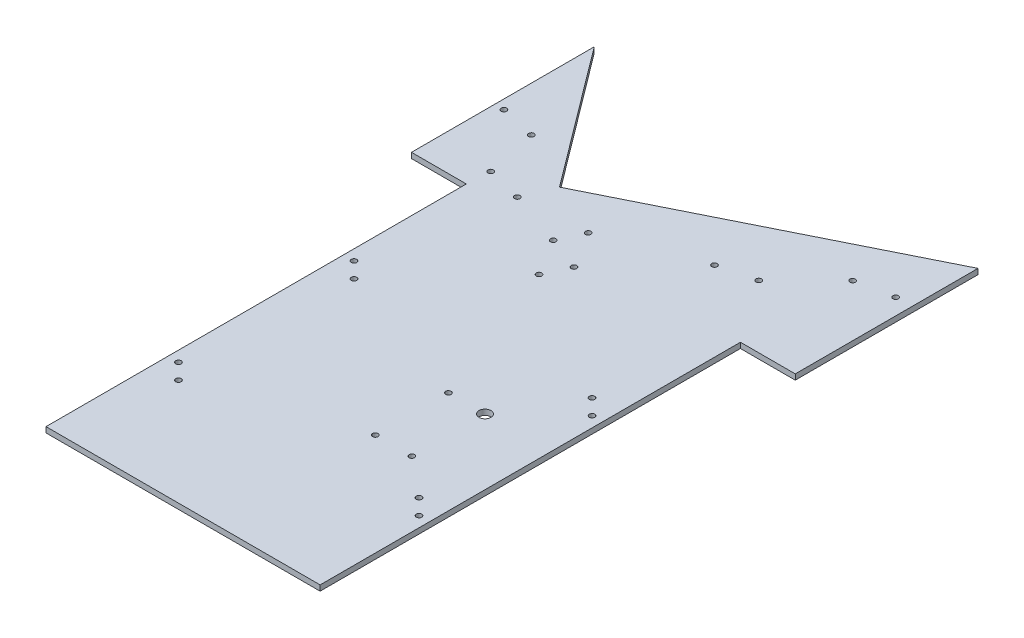
from build123d import *

# Parameters (mm, degrees)
SKETCH1_W           = 150
SKETCH1_H           = 200
SKETCH1_R           = 1.5
SKETCH1_R_2         = 3.263802796
BOSS_EXTRUDE1_DEPTH = 3
SKETCH2_R           = 1.5
SKETCH2_R_2         = 1.500000003
SKETCH2_R_3         = 1.500000002
SKETCH2_R_4         = 1.499999997
SKETCH2_R_5         = 1.499999998
BOSS_EXTRUDE3_DEPTH = 3


with BuildPart() as part:
    # Sketch1 → Boss-Extrude1 (new body)
    with BuildSketch(Plane(origin=(0, 0, 0), x_dir=(1, 0, 0), z_dir=(0, 1, 0))):
        Rectangle(SKETCH1_W, SKETCH1_H)
        with Locations((-69.242640687, 62.79605759)):
            Circle(SKETCH1_R, mode=Mode.SUBTRACT)
        with Locations((-60.757359313, 54.310776216)):
            Circle(SKETCH1_R, mode=Mode.SUBTRACT)
        with Locations((60.757359313, 63.034810844)):
            Circle(SKETCH1_R, mode=Mode.SUBTRACT)
        with Locations((69.242640687, 54.54952947)):
            Circle(SKETCH1_R, mode=Mode.SUBTRACT)
        with Locations((-69.242640687, -33.274226936)):
            Circle(SKETCH1_R, mode=Mode.SUBTRACT)
        with Locations((-60.757359313, -41.75950831)):
            Circle(SKETCH1_R, mode=Mode.SUBTRACT)
        with Locations((60.757359313, -31.641853854)):
            Circle(SKETCH1_R, mode=Mode.SUBTRACT)
        with Locations((69.242640687, -40.127135228)):
            Circle(SKETCH1_R, mode=Mode.SUBTRACT)
        with Locations((19.1, 26.102840582)):
            Circle(SKETCH1_R, mode=Mode.SUBTRACT)
        with Locations((39.1, 26.102840582)):
            Circle(SKETCH1_R_2, mode=Mode.SUBTRACT)
        with Locations((39.1, -13.897159418)):
            Circle(SKETCH1_R, mode=Mode.SUBTRACT)
        with Locations((19.1, -13.897159418)):
            Circle(SKETCH1_R, mode=Mode.SUBTRACT)
    extrude(amount=BOSS_EXTRUDE1_DEPTH)

    # Sketch2 → Boss-Extrude3 (add)
    with BuildSketch(Plane(origin=(0, 3, 0), x_dir=(1, 0, 0), z_dir=(0, 1, 0))):
        Polygon((-75, 100), (-75, 130), (-105, 130), (-105, 230), (-48, 154), (105, 230), (105, 130), (75, 130), (75, 100), align=None)
        with Locations((-12.213557683, 106.98379185)):
            Circle(SKETCH2_R, mode=Mode.SUBTRACT)
        with Locations((-6.161864228, 120.074895942)):
            Circle(SKETCH2_R, mode=Mode.SUBTRACT)
        with Locations((-18.479232595, 140.175014292)):
            Circle(SKETCH2_R, mode=Mode.SUBTRACT)
        with Locations((-24.530926049, 127.0839102)):
            Circle(SKETCH2_R, mode=Mode.SUBTRACT)
        with Locations((31.340042848, 159.444468607)):
            Circle(SKETCH2_R_2, mode=Mode.SUBTRACT)
        with Locations((50.742574777, 164.296453223)):
            Circle(SKETCH2_R_2, mode=Mode.SUBTRACT)
        with Locations((76.536595955, 189.883247415)):
            Circle(SKETCH2_R_3, mode=Mode.SUBTRACT)
        with Locations((96.155699062, 193.767934439)):
            Circle(SKETCH2_R_3, mode=Mode.SUBTRACT)
        with Locations((-54.819560494, 137.744411735)):
            Circle(SKETCH2_R_4, mode=Mode.SUBTRACT)
        with Locations((-74.222092424, 142.596396351)):
            Circle(SKETCH2_R_4, mode=Mode.SUBTRACT)
        with Locations((-80.424369554, 170.997069146)):
            Circle(SKETCH2_R_5, mode=Mode.SUBTRACT)
        with Locations((-99.915689565, 175.479082556)):
            Circle(SKETCH2_R_5, mode=Mode.SUBTRACT)
    extrude(amount=-BOSS_EXTRUDE3_DEPTH)


solid = part.part
